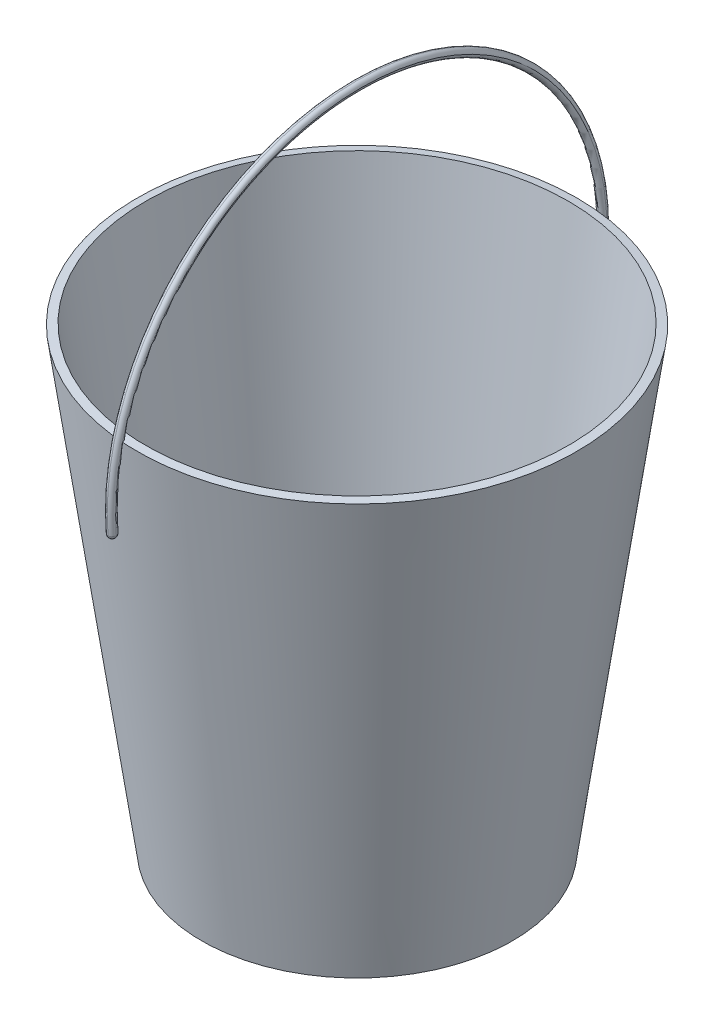
from build123d import *

# Parameters (mm, degrees)
EXTRUDE_THIN1_DEPTH = 1
FILLET1_R           = 1


with BuildPart() as part:
    # Sketch1 → Revolve1 (revolve)
    with BuildSketch(Plane.XY, mode=Mode.PRIVATE) as revolve1_sk:
        Polygon((0, 0), (37.5, 0), (53, 110), (51.019564504, 110.279061365), (35.762060402, 2), (0, 2), align=None)
    revolve(revolve1_sk.sketch.rotate(Axis((0, 0, 0), (0, 1, 0)), 90), axis=Axis((0, 0, 0), (0, 1, 0)))


with BuildPart() as body_2:
    # Sketch2 → Extrude-Thin1 (new, symmetric)
    with BuildSketch(Plane(origin=(0, 0, 0), x_dir=(0, 0, -1), z_dir=(1, 0, 0))):
        with BuildLine():
            ThreePointArc((-58.004671684, 95.096548144), (0, 159), (58.004671684, 95.096548144))
            Line((58.004671684, 95.096548144), (59.995328316, 94.903451856))
            ThreePointArc((59.995328316, 94.903451856), (0, 161), (-59.995328316, 94.903451856))
            Line((-59.995328316, 94.903451856), (-58.004671684, 95.096548144))
        make_face()
    extrude(amount=EXTRUDE_THIN1_DEPTH, both=True)

    # Fillet1
    fillet1_edges = [body_2.edges().sort_by_distance(p)[0] for p in [
        (1, 161, 0),
        (1, 95, 59),
        (-1, 95, 59),
        (1, 159, 0),
        (-1, 161, 0),
        (-1, 95, -59),
        (-1, 159, 0),
        (0, 95.096548144, 58.004671684),
        (0, 94.903451856, 59.995328316),
        (0, 94.903451856, -59.995328316),
        (0, 95.096548144, -58.004671684),
        (1, 95, -59),
    ]]
    fillet(fillet1_edges, radius=FILLET1_R - 0.0001)  # a hair under: the kernel refuses the full size


solid = Compound([part.part, body_2.part])
